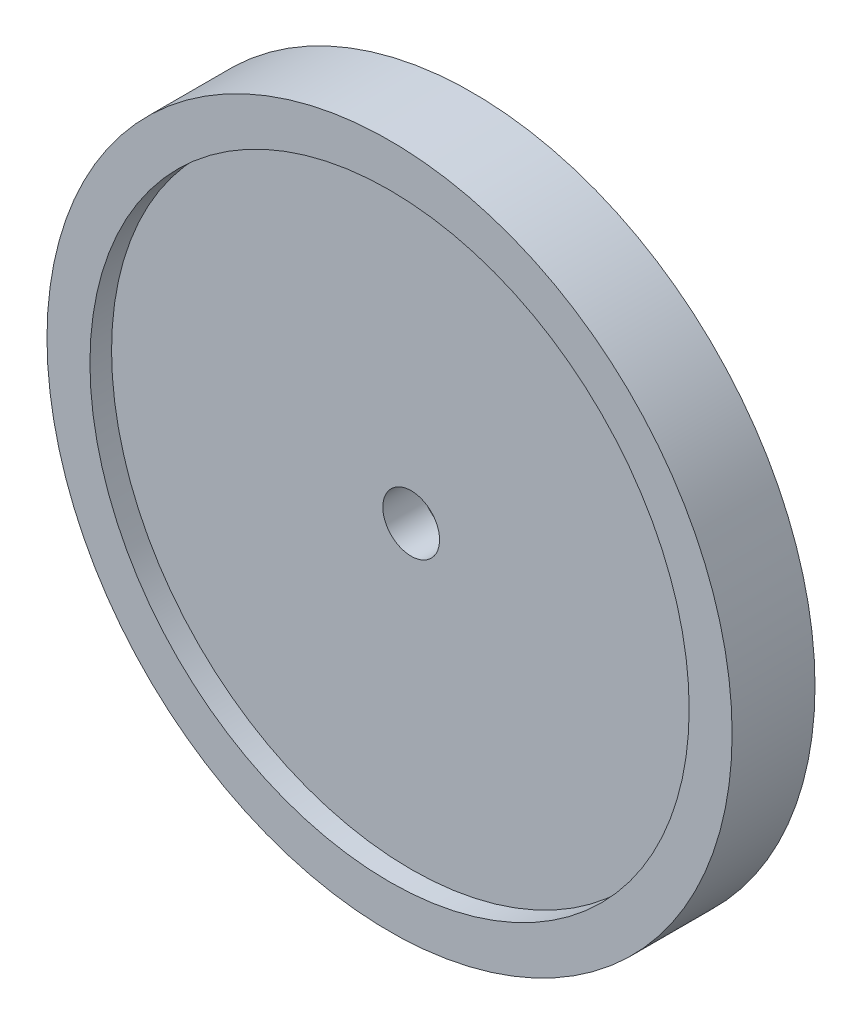
from build123d import *

# Parameters (mm, degrees)
SKETCH1_R           = 24.145
SKETCH1_R_2         = 2
BOSS_EXTRUDE1_DEPTH = 5.842
SKETCH2_R           = 21.117638057
CUT_EXTRUDE1_DEPTH  = 1.524


with BuildPart() as part:
    # Sketch1 → Boss-Extrude1 (new body)
    with BuildSketch(Plane.XY.offset(3.175)):
        with Locations((-35.533137827, 0)):
            Circle(SKETCH1_R)
        with Locations((-35.533137827, 0)):
            Circle(SKETCH1_R_2, mode=Mode.SUBTRACT)
    extrude(amount=BOSS_EXTRUDE1_DEPTH)

    # Sketch2 → Cut-Extrude1 (cut)
    with BuildSketch(Plane.XY.offset(9.017)):
        with Locations((-35.533137827, 0)):
            Circle(SKETCH2_R)
    cut_extrude1 = extrude(amount=-CUT_EXTRUDE1_DEPTH, mode=Mode.SUBTRACT)

    # Mirror1: Cut-Extrude1 across plane
    add(cut_extrude1.mirror(Plane.XY.offset(6.096)), mode=Mode.SUBTRACT)


solid = part.part
